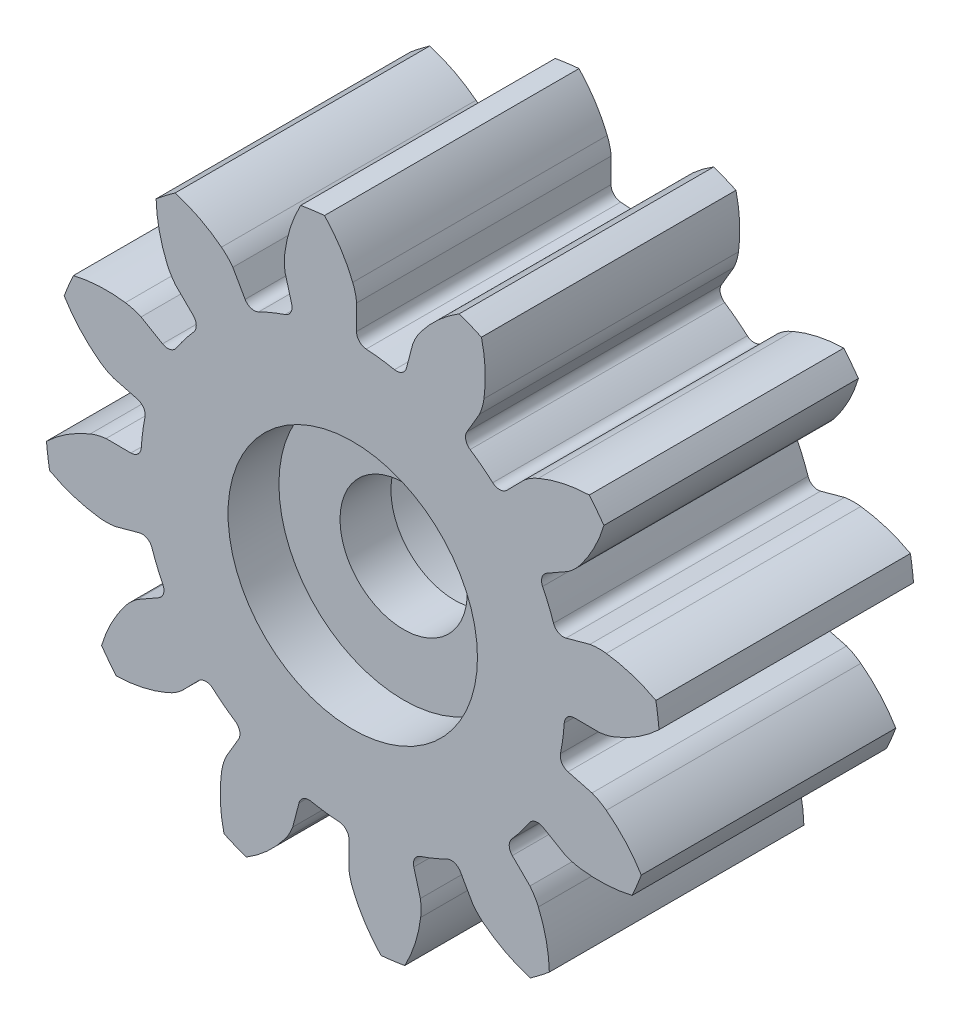
from build123d import *

# Parameters (mm, degrees)
BOSS_EXTRUDE1_DEPTH      = 1
BOSS_EXTRUDE1_DEPTH_BACK = 4
SKETCH1_R                = 2.45
BOSS_EXTRUDE2_START      = -3
SKETCH2_R                = 2.45
SKETCH2_R_2              = 1.25
BOSS_EXTRUDE2_DEPTH      = 1


with BuildPart() as part:
    # Sketch1 → Boss-Extrude1 (new, two sides: drawn at the far end of the back side and taken through both)
    with BuildSketch(Plane.XY.offset(-BOSS_EXTRUDE1_DEPTH_BACK)):
        with BuildLine():
            Line((-1.328942795, 4.660504482), (-1.19987949, 4.189818801))
            ThreePointArc((-1.19987949, 4.189818801), (-1.216390887, 4.041213658), (-1.330404162, 3.944481617))
            ThreePointArc((-1.330404162, 3.944481617), (-1.593034897, 3.845926453), (-1.848431895, 3.729907504))
            ThreePointArc((-1.848431895, 3.729907504), (-1.997451337, 3.717687826), (-2.114206362, 3.81109221))
            Line((-2.114206362, 3.81109221), (-2.35576986, 4.235178785))
            ThreePointArc((-2.35576986, 4.235178785), (-2.458763141, 4.358582017), (-2.578277712, 4.466063368))
            ThreePointArc((-2.578277712, 4.466063368), (-3.011522784, 4.742385054), (-3.488492609, 4.933578024))
            ThreePointArc((-3.488492609, 4.933578024), (-3.678338502, 4.793704066), (-3.862582103, 4.646529059))
            ThreePointArc((-3.862582103, 4.646529059), (-3.80135275, 4.136327205), (-3.646578574, 3.646327286))
            ThreePointArc((-3.646578574, 3.646327286), (-3.573692208, 3.503066854), (-3.481150462, 3.371643878))
            Line((-3.481150462, 3.371643878), (-3.13403552, 3.028549774))
            ThreePointArc((-3.13403552, 3.028549774), (-3.074032238, 2.891598246), (-3.12440461, 2.750819204))
            ThreePointArc((-3.12440461, 2.750819204), (-3.302571916, 2.534152561), (-3.46574273, 2.305978705))
            ThreePointArc((-3.46574273, 2.305978705), (-3.588687514, 2.220886432), (-3.736502523, 2.243399489))
            Line((-3.736502523, 2.243399489), (-4.157745937, 2.489887487))
            ThreePointArc((-4.157745937, 2.489887487), (-4.308642351, 2.545261181), (-4.465885681, 2.578585476))
            ThreePointArc((-4.465885681, 2.578585476), (-4.979247762, 2.601264539), (-5.487912233, 2.528357596))
            ThreePointArc((-5.487912233, 2.528357596), (-5.582386619, 2.312300248), (-5.668358756, 2.092721153))
            ThreePointArc((-5.668358756, 2.092721153), (-5.360231653, 1.681488063), (-4.981193325, 1.334522773))
            ThreePointArc((-4.981193325, 1.334522773), (-4.846441665, 1.246898783), (-4.700586673, 1.17935402))
            Line((-4.700586673, 1.17935402), (-4.228429264, 1.05578328))
            ThreePointArc((-4.228429264, 1.05578328), (-4.107989133, 0.96718142), (-4.081223366, 0.820077007))
            ThreePointArc((-4.081223366, 0.820077007), (-4.127187457, 0.543354537), (-4.1544106, 0.264164774))
            ThreePointArc((-4.1544106, 0.264164774), (-4.218337769, 0.129000312), (-4.357605851, 0.074589687))
            Line((-4.357605851, 0.074589687), (-4.845657348, 0.077432848))
            ThreePointArc((-4.845657348, 0.077432848), (-5.004024322, 0.049939666), (-5.156863188, 0.000177687))
            ThreePointArc((-5.156863188, 0.000177687), (-5.612787323, -0.236862708), (-6.016850205, -0.554334209))
            ThreePointArc((-6.016850205, -0.554334209), (-5.99063875, -0.788682554), (-5.955303257, -1.021829696))
            ThreePointArc((-5.955303257, -1.021829696), (-5.482840813, -1.223904448), (-4.981101347, -1.334866039))
            ThreePointArc((-4.981101347, -1.334866039), (-4.820590991, -1.34337481), (-4.660504482, -1.328942795))
            Line((-4.660504482, -1.328942795), (-4.189818801, -1.19987949))
            ThreePointArc((-4.189818801, -1.19987949), (-4.041213658, -1.216390887), (-3.944481617, -1.330404162))
            ThreePointArc((-3.944481617, -1.330404162), (-3.845926453, -1.593034897), (-3.729907504, -1.848431895))
            ThreePointArc((-3.729907504, -1.848431895), (-3.717687826, -1.997451337), (-3.81109221, -2.114206362))
            Line((-3.81109221, -2.114206362), (-4.235178785, -2.35576986))
            ThreePointArc((-4.235178785, -2.35576986), (-4.358582017, -2.458763141), (-4.466063368, -2.578277712))
            ThreePointArc((-4.466063368, -2.578277712), (-4.742385054, -3.011522784), (-4.933578024, -3.488492609))
            ThreePointArc((-4.933578024, -3.488492609), (-4.793704066, -3.678338502), (-4.646529059, -3.862582103))
            ThreePointArc((-4.646529059, -3.862582103), (-4.136327205, -3.80135275), (-3.646327286, -3.646578574))
            ThreePointArc((-3.646327286, -3.646578574), (-3.503066854, -3.573692208), (-3.371643878, -3.481150462))
            Line((-3.371643878, -3.481150462), (-3.028549774, -3.13403552))
            ThreePointArc((-3.028549774, -3.13403552), (-2.891598246, -3.074032238), (-2.750819204, -3.12440461))
            ThreePointArc((-2.750819204, -3.12440461), (-2.534152561, -3.302571916), (-2.305978705, -3.46574273))
            ThreePointArc((-2.305978705, -3.46574273), (-2.220886432, -3.588687514), (-2.243399489, -3.736502523))
            Line((-2.243399489, -3.736502523), (-2.489887487, -4.157745937))
            ThreePointArc((-2.489887487, -4.157745937), (-2.545261181, -4.308642351), (-2.578585476, -4.465885681))
            ThreePointArc((-2.578585476, -4.465885681), (-2.601264539, -4.979247762), (-2.528357596, -5.487912233))
            ThreePointArc((-2.528357596, -5.487912233), (-2.312300248, -5.582386619), (-2.092721153, -5.668358756))
            ThreePointArc((-2.092721153, -5.668358756), (-1.681488063, -5.360231653), (-1.334522773, -4.981193325))
            ThreePointArc((-1.334522773, -4.981193325), (-1.246898783, -4.846441665), (-1.17935402, -4.700586673))
            Line((-1.17935402, -4.700586673), (-1.05578328, -4.228429264))
            ThreePointArc((-1.05578328, -4.228429264), (-0.96718142, -4.107989133), (-0.820077007, -4.081223366))
            ThreePointArc((-0.820077007, -4.081223366), (-0.543354537, -4.127187457), (-0.264164774, -4.1544106))
            ThreePointArc((-0.264164774, -4.1544106), (-0.129000312, -4.218337769), (-0.074589687, -4.357605851))
            Line((-0.074589687, -4.357605851), (-0.077432848, -4.845657348))
            ThreePointArc((-0.077432848, -4.845657348), (-0.049939666, -5.004024322), (-0.000177687, -5.156863188))
            ThreePointArc((-0.000177687, -5.156863188), (0.236862708, -5.612787323), (0.554334209, -6.016850205))
            ThreePointArc((0.554334209, -6.016850205), (0.788682554, -5.99063875), (1.021829696, -5.955303257))
            ThreePointArc((1.021829696, -5.955303257), (1.223904448, -5.482840813), (1.334866039, -4.981101347))
            ThreePointArc((1.334866039, -4.981101347), (1.34337481, -4.820590991), (1.328942795, -4.660504482))
            Line((1.328942795, -4.660504482), (1.19987949, -4.189818801))
            ThreePointArc((1.19987949, -4.189818801), (1.216390887, -4.041213658), (1.330404162, -3.944481617))
            ThreePointArc((1.330404162, -3.944481617), (1.593034897, -3.845926453), (1.848431895, -3.729907504))
            ThreePointArc((1.848431895, -3.729907504), (1.997451337, -3.717687826), (2.114206362, -3.81109221))
            Line((2.114206362, -3.81109221), (2.35576986, -4.235178785))
            ThreePointArc((2.35576986, -4.235178785), (2.458763141, -4.358582017), (2.578277712, -4.466063368))
            ThreePointArc((2.578277712, -4.466063368), (3.011522784, -4.742385054), (3.488492609, -4.933578024))
            ThreePointArc((3.488492609, -4.933578024), (3.678338502, -4.793704066), (3.862582103, -4.646529059))
            ThreePointArc((3.862582103, -4.646529059), (3.80135275, -4.136327205), (3.646578574, -3.646327286))
            ThreePointArc((3.646578574, -3.646327286), (3.573692208, -3.503066854), (3.481150462, -3.371643878))
            Line((3.481150462, -3.371643878), (3.13403552, -3.028549774))
            ThreePointArc((3.13403552, -3.028549774), (3.074032238, -2.891598246), (3.12440461, -2.750819204))
            ThreePointArc((3.12440461, -2.750819204), (3.302571916, -2.534152561), (3.46574273, -2.305978705))
            ThreePointArc((3.46574273, -2.305978705), (3.588687514, -2.220886432), (3.736502523, -2.243399489))
            Line((3.736502523, -2.243399489), (4.157745937, -2.489887487))
            ThreePointArc((4.157745937, -2.489887487), (4.308642351, -2.545261181), (4.465885681, -2.578585476))
            ThreePointArc((4.465885681, -2.578585476), (4.979247762, -2.601264539), (5.487912233, -2.528357596))
            ThreePointArc((5.487912233, -2.528357596), (5.582386619, -2.312300248), (5.668358756, -2.092721153))
            ThreePointArc((5.668358756, -2.092721153), (5.360231653, -1.681488063), (4.981193325, -1.334522773))
            ThreePointArc((4.981193325, -1.334522773), (4.846441665, -1.246898783), (4.700586673, -1.17935402))
            Line((4.700586673, -1.17935402), (4.228429264, -1.05578328))
            ThreePointArc((4.228429264, -1.05578328), (4.107989133, -0.96718142), (4.081223366, -0.820077007))
            ThreePointArc((4.081223366, -0.820077007), (4.127187457, -0.543354537), (4.1544106, -0.264164774))
            ThreePointArc((4.1544106, -0.264164774), (4.218337769, -0.129000312), (4.357605851, -0.074589687))
            Line((4.357605851, -0.074589687), (4.845657348, -0.077432848))
            ThreePointArc((4.845657348, -0.077432848), (5.004024322, -0.049939666), (5.156863188, -0.000177687))
            ThreePointArc((5.156863188, -0.000177687), (5.612787323, 0.236862708), (6.016850205, 0.554334209))
            ThreePointArc((6.016850205, 0.554334209), (5.99063875, 0.788682554), (5.955303257, 1.021829696))
            ThreePointArc((5.955303257, 1.021829696), (5.482840813, 1.223904448), (4.981101347, 1.334866039))
            ThreePointArc((4.981101347, 1.334866039), (4.820590991, 1.34337481), (4.660504482, 1.328942795))
            Line((4.660504482, 1.328942795), (4.189818801, 1.19987949))
            ThreePointArc((4.189818801, 1.19987949), (4.041213658, 1.216390887), (3.944481617, 1.330404162))
            ThreePointArc((3.944481617, 1.330404162), (3.845926453, 1.593034897), (3.729907504, 1.848431895))
            ThreePointArc((3.729907504, 1.848431895), (3.717687826, 1.997451337), (3.81109221, 2.114206362))
            Line((3.81109221, 2.114206362), (4.235178785, 2.35576986))
            ThreePointArc((4.235178785, 2.35576986), (4.358582017, 2.458763141), (4.466063368, 2.578277712))
            ThreePointArc((4.466063368, 2.578277712), (4.742385054, 3.011522784), (4.933578024, 3.488492609))
            ThreePointArc((4.933578024, 3.488492609), (4.793704066, 3.678338502), (4.646529059, 3.862582103))
            ThreePointArc((4.646529059, 3.862582103), (4.136327205, 3.80135275), (3.646327286, 3.646578574))
            ThreePointArc((3.646327286, 3.646578574), (3.503066854, 3.573692208), (3.371643878, 3.481150462))
            Line((3.371643878, 3.481150462), (3.028549774, 3.13403552))
            ThreePointArc((3.028549774, 3.13403552), (2.891598246, 3.074032238), (2.750819204, 3.12440461))
            ThreePointArc((2.750819204, 3.12440461), (2.534152561, 3.302571916), (2.305978705, 3.46574273))
            ThreePointArc((2.305978705, 3.46574273), (2.220886432, 3.588687514), (2.243399489, 3.736502523))
            Line((2.243399489, 3.736502523), (2.489887487, 4.157745937))
            ThreePointArc((2.489887487, 4.157745937), (2.545261181, 4.308642351), (2.578585476, 4.465885681))
            ThreePointArc((2.578585476, 4.465885681), (2.601264539, 4.979247762), (2.528357596, 5.487912233))
            ThreePointArc((2.528357596, 5.487912233), (2.312300248, 5.582386619), (2.092721153, 5.668358756))
            ThreePointArc((2.092721153, 5.668358756), (1.681488063, 5.360231653), (1.334522773, 4.981193325))
            ThreePointArc((1.334522773, 4.981193325), (1.246898783, 4.846441665), (1.17935402, 4.700586673))
            Line((1.17935402, 4.700586673), (1.05578328, 4.228429264))
            ThreePointArc((1.05578328, 4.228429264), (0.96718142, 4.107989133), (0.820077007, 4.081223366))
            ThreePointArc((0.820077007, 4.081223366), (0.543354537, 4.127187457), (0.264164774, 4.1544106))
            ThreePointArc((0.264164774, 4.1544106), (0.129000312, 4.218337769), (0.074589687, 4.357605851))
            Line((0.074589687, 4.357605851), (0.077432848, 4.845657348))
            ThreePointArc((0.077432848, 4.845657348), (0.049939666, 5.004024322), (0.000177687, 5.156863188))
            ThreePointArc((0.000177687, 5.156863188), (-0.236862708, 5.612787323), (-0.554334209, 6.016850205))
            ThreePointArc((-0.554334209, 6.016850205), (-0.788682554, 5.99063875), (-1.021829696, 5.955303257))
            ThreePointArc((-1.021829696, 5.955303257), (-1.223904448, 5.482840813), (-1.334866039, 4.981101347))
            ThreePointArc((-1.334866039, 4.981101347), (-1.34337481, 4.820590991), (-1.328942795, 4.660504482))
        make_face()
        Circle(SKETCH1_R, mode=Mode.SUBTRACT)
    extrude(amount=BOSS_EXTRUDE1_DEPTH + BOSS_EXTRUDE1_DEPTH_BACK)

    # Sketch2 → Boss-Extrude2 (add)
    with BuildSketch(Plane(origin=(0, 0, -4), x_dir=(-1, 0, 0), z_dir=(0, 0, -1)).offset(BOSS_EXTRUDE2_START)):
        Circle(SKETCH2_R)
        Circle(SKETCH2_R_2, mode=Mode.SUBTRACT)
    extrude(amount=-BOSS_EXTRUDE2_DEPTH)


solid = part.part
